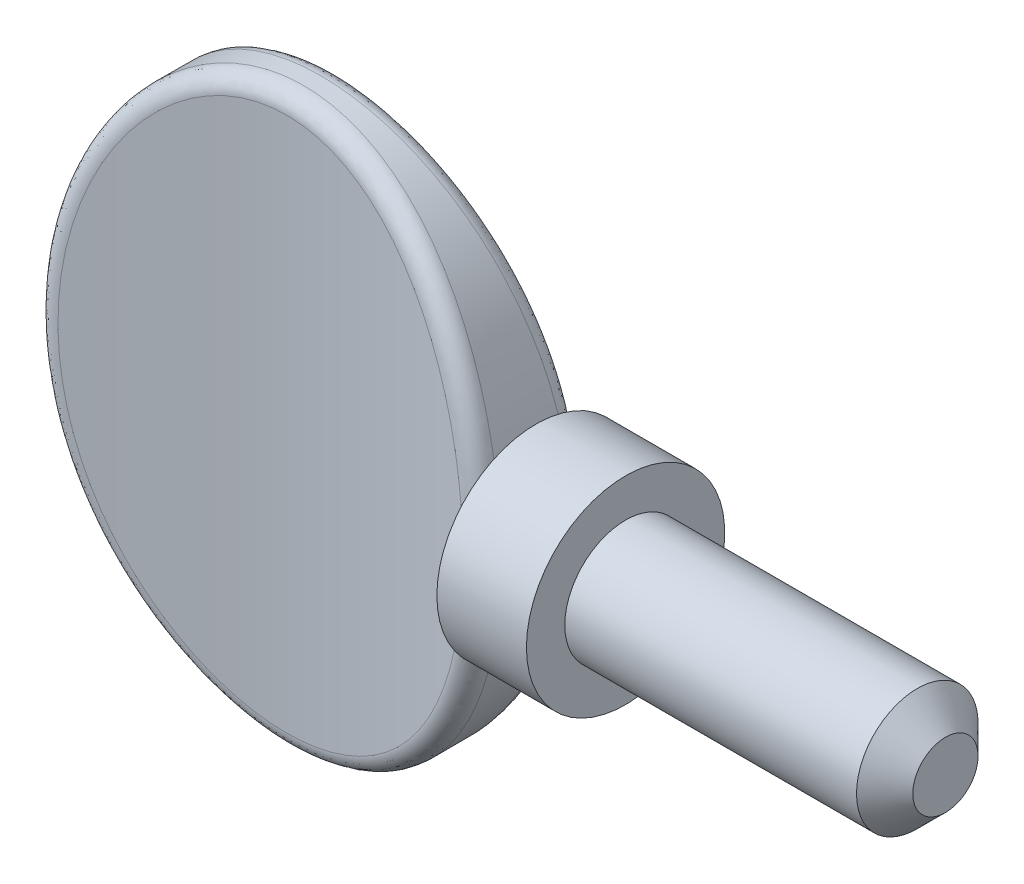
from build123d import *

# Parameters (mm, degrees)
SKETCH1_RX              = 11.303
SKETCH1_RY              = 8.889999999999999
EXTRUDE1_DEPTH          = 2.286
CUT_EXTRUDE1_DEPTH      = 15.560759080487529
CUT_EXTRUDE1_DEPTH_BACK = 15.560759080487529
SKETCH2_OUTSIDE_W       = 25.603999999999996
SKETCH2_OUTSIDE_H       = 12.396
FILLET3_R               = 0.6773333333333333


with BuildPart() as part:
    # Sketch1 → Extrude1 (new, symmetric)
    with BuildSketch(Plane.XY):
        with Locations(Location((0, 0), (0, 0, 90))):
            Ellipse(SKETCH1_RX, SKETCH1_RY)
    extrude(amount=EXTRUDE1_DEPTH, both=True)

    # Sketch2 outside → Cut-Extrude1 (cut, two sides: drawn at the far end of the back side and taken through both)
    with BuildSketch(Plane(origin=(0, 0, 0), x_dir=(1, 0, 0), z_dir=(0, 1, 0)).offset(-CUT_EXTRUDE1_DEPTH_BACK)):
        Rectangle(SKETCH2_OUTSIDE_W, SKETCH2_OUTSIDE_H)
        with BuildLine():
            Line((-8.889999999999999, 2.286), (-8.889999999999999, -2.286))
            ThreePointArc((-8.889999999999999, -2.286), (1.94e-15, -1.0159999999999982), (8.889999999999999, -2.286))
            Line((8.889999999999999, -2.286), (8.889999999999999, 2.286))
            ThreePointArc((8.889999999999999, 2.286), (1.94e-15, 1.0159999999999982), (-8.889999999999999, 2.286))
        make_face(mode=Mode.SUBTRACT)
    extrude(amount=CUT_EXTRUDE1_DEPTH + CUT_EXTRUDE1_DEPTH_BACK, mode=Mode.SUBTRACT)

    # Fillet3
    fillet3_edges = [part.edges().sort_by_distance(p)[0] for p in [
        (-6.499256061e-08, -11.302999999991183, 1.0159999999964504),
        (8.835220095e-08, -11.302999999991183, -1.0159999999964522),
    ]]
    fillet(fillet3_edges, radius=FILLET3_R)

    # Sketch3 → Revolve1 (revolve)
    with BuildSketch(Plane(origin=(0, 0, 0), x_dir=(1, 0, 0), z_dir=(0, 1, 0))):
        with BuildLine():
            Line((12.445999999999996, 3.9369999999999994), (12.445999999999996, 2.413))
            Line((12.445999999999996, 2.413), (24.028399999999984, 2.413))
            Line((24.028399999999984, 2.413), (25.145999999999994, 1.2953999999999999))
            Line((25.145999999999994, 1.2953999999999999), (25.145999999999994, 0))
            Line((25.145999999999994, 0), (7.236423048052516, 0))
            Line((7.236423048052516, 0), (7.236423048052516, 1.8516557328217895))
            ThreePointArc((7.236423048052516, 1.8516557328217895), (8.426438076724871, 2.6063068114075874), (8.889999999999999, 3.9370000000000003))
            Line((8.889999999999999, 3.9370000000000003), (12.445999999999996, 3.9369999999999994))
        make_face()
    revolve(axis=Axis((0, 0, 0), (1, 0, 0)))


solid = part.part
